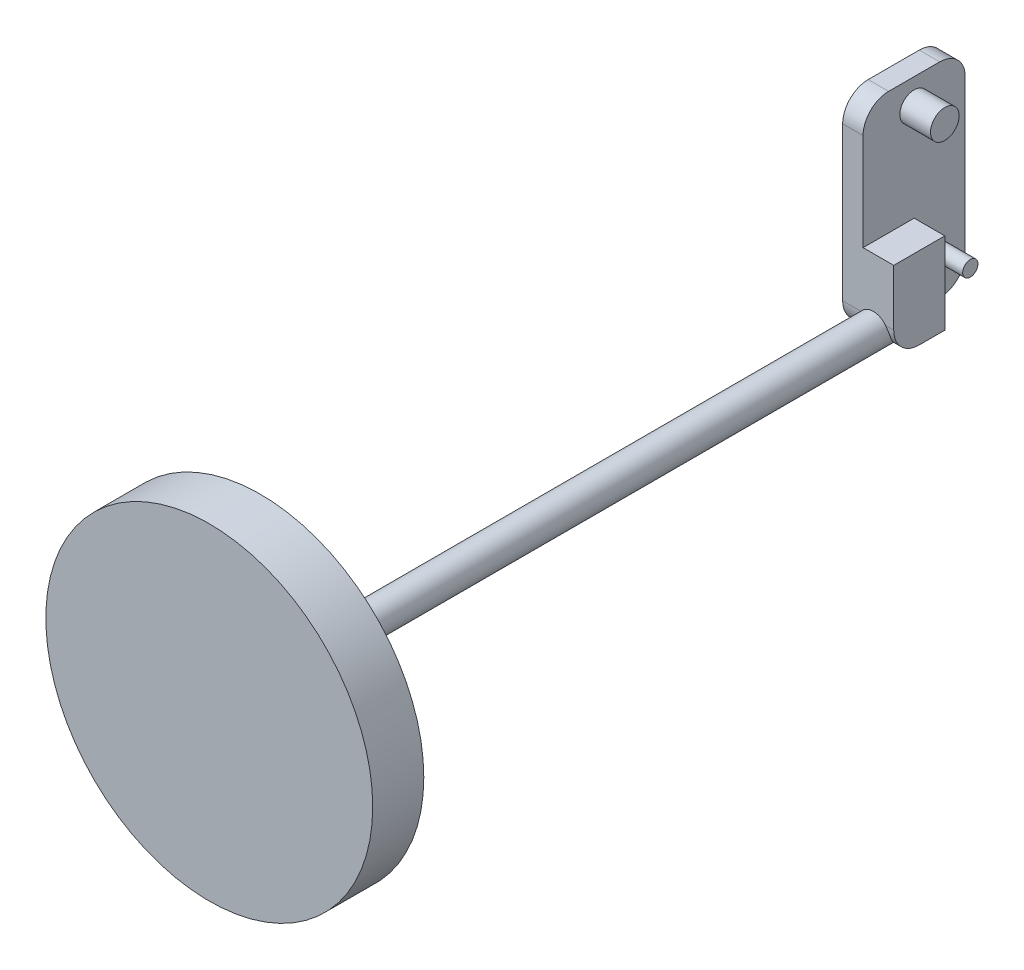
from build123d import *

# Parameters (mm, degrees)
SKETCH1_R           = 400
BOSS_EXTRUDE1_DEPTH = 125
SKETCH2_R           = 37.5
BOSS_EXTRUDE2_DEPTH = 1500
SKETCH3_W           = 50
SKETCH3_H           = 500
BOSS_EXTRUDE3_DEPTH = 250
SKETCH4_R           = 18.75
SKETCH4_R_2         = 35
SKETCH4_W           = 125
SKETCH4_H           = 200
BOSS_EXTRUDE4_DEPTH = 75
FILLET1_R           = 62.5


with BuildPart() as part:
    # Sketch1 → Boss-Extrude1 (new body)
    with BuildSketch(Plane.XY):
        Circle(SKETCH1_R)
    extrude(amount=BOSS_EXTRUDE1_DEPTH)

    # Sketch2 → Boss-Extrude2 (add)
    with BuildSketch(Plane(origin=(0, 0, 0), x_dir=(-1, 0, 0), z_dir=(0, 0, -1))):
        with Locations(Location((0, 0, 0), (0, 0, 180))):
            Circle(SKETCH2_R)
    extrude(amount=BOSS_EXTRUDE2_DEPTH)

    # Sketch3 → Boss-Extrude3 (add)
    with BuildSketch(Plane(origin=(0, 0, -1500), x_dir=(-1, 0, 0), z_dir=(0, 0, -1))):
        with Locations((50, 210)):
            Rectangle(SKETCH3_W, SKETCH3_H)
    extrude(amount=BOSS_EXTRUDE3_DEPTH)

    # Sketch4 → Boss-Extrude4 (add)
    with BuildSketch(Plane.ZY.offset(25)):
        with Locations(Location((-1687.5, 60, 0), (0, 0, 270))):
            Circle(SKETCH4_R)
        with Locations(Location((-1625, 397.09, 0), (0, 0, 270))):
            Circle(SKETCH4_R_2)
        with Locations((-1562.5, 60)):
            Rectangle(SKETCH4_W, SKETCH4_H)
    extrude(amount=-BOSS_EXTRUDE4_DEPTH)

    # Fillet1
    # the kernel refuses this fillet: 62.5 mm, written as the material it takes off along each edge
    with BuildSketch(Plane(origin=(-231.25, 460, -1500), x_dir=(0, -1, 0), z_dir=(1, 0, 0))) as fillet1_piece_1:
        with BuildLine():
            CenterArc((FILLET1_R, FILLET1_R), FILLET1_R, 180, 90)
            Line((0, FILLET1_R), (0, 0))
            Line((0, 0), (FILLET1_R, 0))
        make_face()
    extrude(amount=362.5, mode=Mode.SUBTRACT)
    with BuildSketch(Plane(origin=(-231.25, -40, -1500), x_dir=(0, 1, 0), z_dir=(1, 0, 0))) as fillet1_piece_2_section:
        with BuildLine():
            CenterArc((FILLET1_R, -FILLET1_R), FILLET1_R, 90, 90)
            Line((0, -FILLET1_R), (0, 0))
            Line((0, 0), (FILLET1_R, 0))
        make_face()
    fillet1_piece_2 = extrude(amount=437.5, mode=Mode.PRIVATE)
    fillet1_piece_2 = fillet1_piece_2 - Plane(origin=(0, 0, -1501.420624631), x_dir=(1, 0, 0), z_dir=(0, 0, 1)) * Cylinder(37.5, 1125, mode=Mode.PRIVATE)
    add(fillet1_piece_2, mode=Mode.SUBTRACT)
    with BuildSketch(Plane(origin=(-231.25, 460, -1750), x_dir=(0, -1, 0), z_dir=(1, 0, 0)), Plane(origin=(131.25, -40, -1750), x_dir=(0, 1, 0), z_dir=(-1, 0, 0))) as fillet1_piece_3:
        with BuildLine():
            CenterArc((FILLET1_R, -FILLET1_R), FILLET1_R, 90, 90)
            Line((0, -FILLET1_R), (0, 0))
            Line((0, 0), (FILLET1_R, 0))
        make_face()
    extrude(amount=362.5, mode=Mode.SUBTRACT)


solid = part.part
